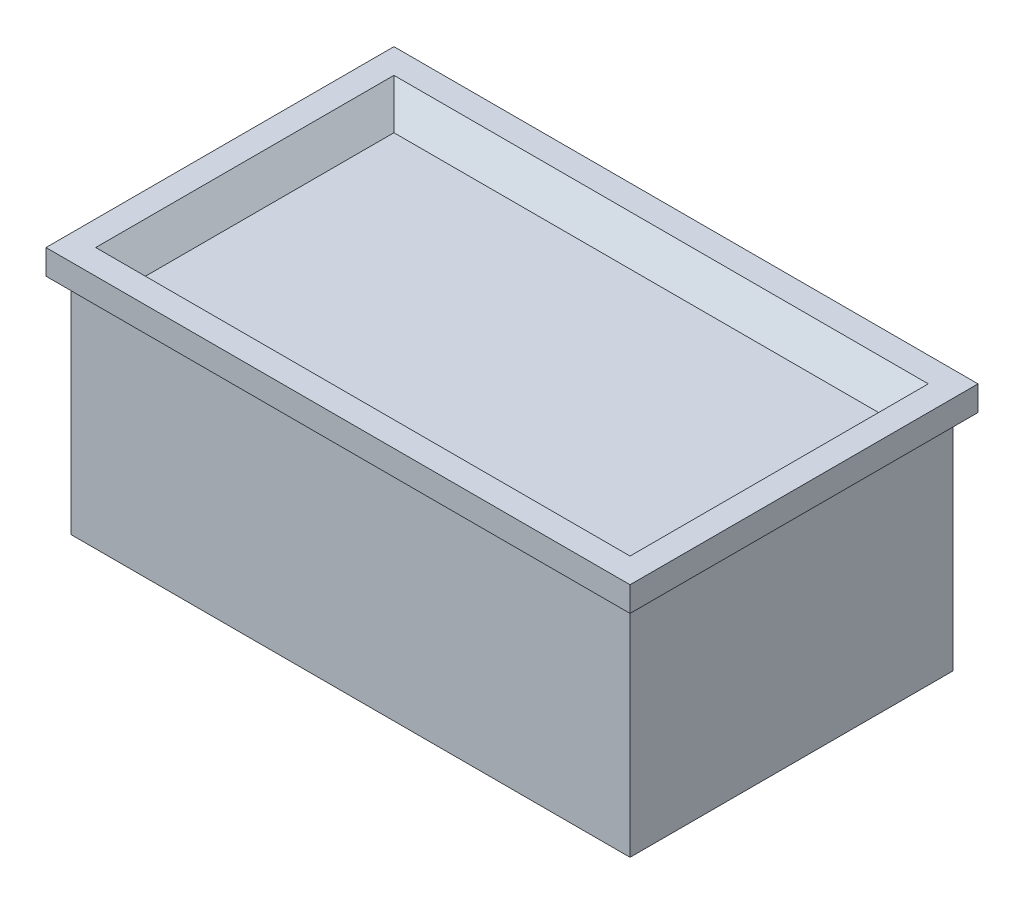
from build123d import *

# Parameters (mm, degrees)
SKETCH_1_W          = 45
SKETCH_1_H          = 26
EXTRUDE_1_DEPTH     = 18
SKETCH_2_W          = 47
SKETCH_2_H          = 28
EXTRUDE_2_DEPTH     = 2
SKETCH_3_W          = 39
SKETCH_3_H          = 20
CUT_EXTRUDE_2_DEPTH = 2
CHAMFER_1_SIZE      = 2


with BuildPart() as part:
    # 草图1 → 凸台-拉伸1 (new body)
    with BuildSketch(Plane(origin=(0, 0, 0), x_dir=(1, 0, 0), z_dir=(0, 1, 0))):
        Rectangle(SKETCH_1_W, SKETCH_1_H)
    extrude(amount=EXTRUDE_1_DEPTH)

    # 草图2 → 凸台-拉伸2 (add)
    with BuildSketch(Plane(origin=(0, 18, 0), x_dir=(1, 0, 0), z_dir=(0, 1, 0))):
        Rectangle(SKETCH_2_W, SKETCH_2_H)
    extrude(amount=EXTRUDE_2_DEPTH)

    # 草图3 → 切除-拉伸2 (cut)
    with BuildSketch(Plane(origin=(0, 20, 0), x_dir=(1, 0, 0), z_dir=(0, 1, 0))):
        Rectangle(SKETCH_3_W, SKETCH_3_H)
    extrude(amount=-CUT_EXTRUDE_2_DEPTH, mode=Mode.SUBTRACT)

    # 倒角1
    chamfer_1_edges = [part.edges().sort_by_distance(p)[0] for p in [
        (-19.5, 20, 0),
        (0, 20, 10),
        (19.5, 20, 0),
        (0, 20, -10),
    ]]
    chamfer(chamfer_1_edges, length=CHAMFER_1_SIZE - 0.0001)  # a hair under: the kernel refuses the full size


solid = part.part
